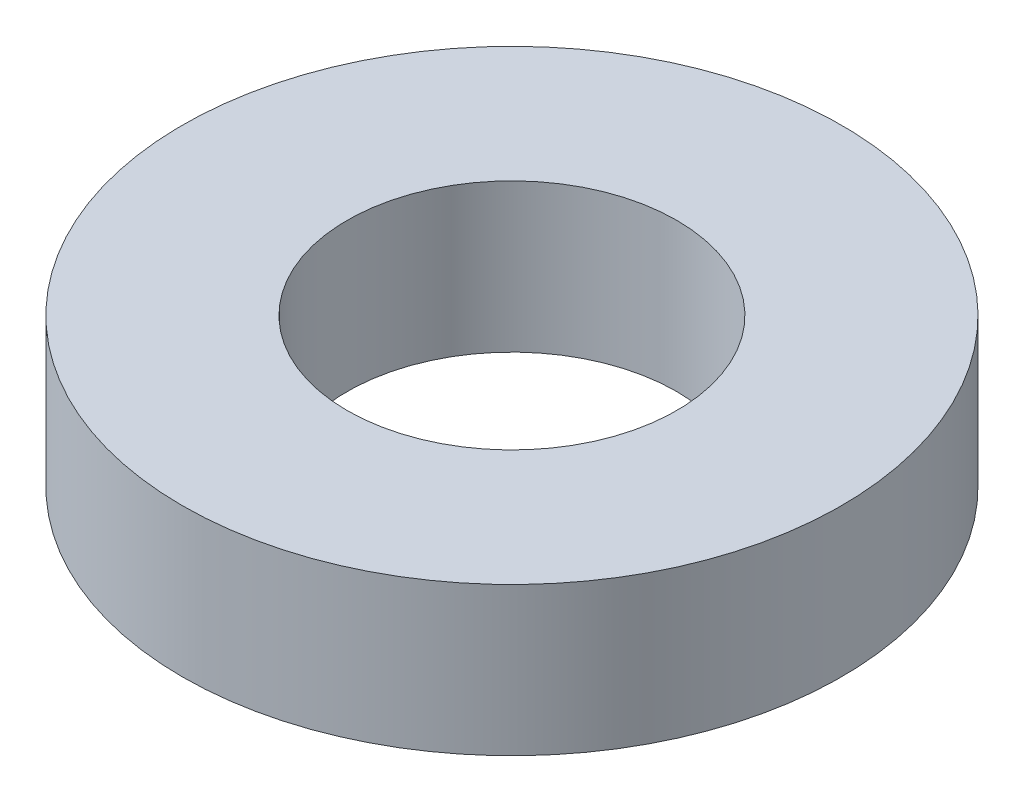
from build123d import *

# Parameters (mm, degrees)
SKETCH1_R           = 60
BOSS_EXTRUDE1_DEPTH = 27
SKETCH2_R           = 30
CUT_EXTRUDE1_DEPTH  = 90.044932478


with BuildPart() as part:
    # Sketch1 → Boss-Extrude1 (new body)
    with BuildSketch(Plane(origin=(0, 0, 0), x_dir=(1, 0, 0), z_dir=(0, 1, 0))):
        Circle(SKETCH1_R)
    extrude(amount=BOSS_EXTRUDE1_DEPTH)

    # Sketch2 → Cut-Extrude1 (cut, through all)
    with BuildSketch(Plane(origin=(0, 0, 0), x_dir=(1, 0, 0), z_dir=(0, 1, 0))):
        Circle(SKETCH2_R)
    extrude(amount=CUT_EXTRUDE1_DEPTH, mode=Mode.SUBTRACT)


solid = part.part
